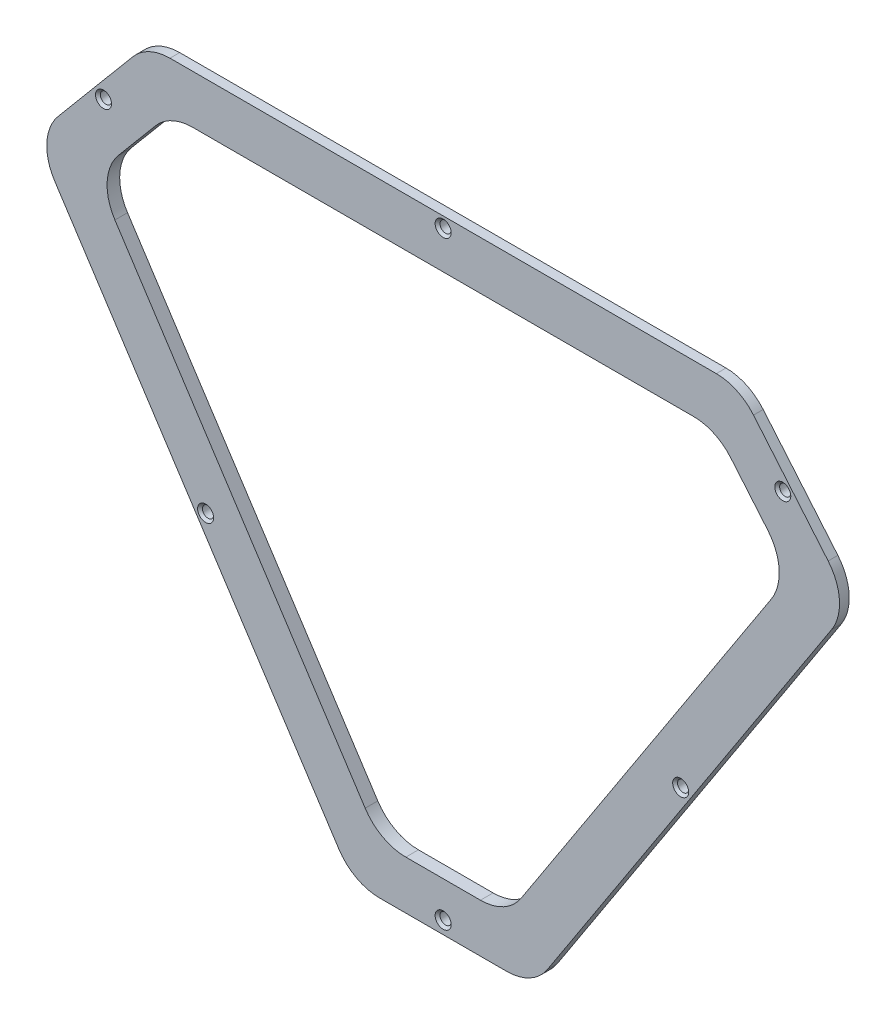
from build123d import *

# Parameters (mm, degrees)
BOSS_EXTRU_1_DEPTH      = 2
CONG_1_R                = 10
ENL_V_MAT_EXTRU_1_DEPTH = 2
BOSS_EXTRU_2_DEPTH      = 0.6
CONG_2_R                = 10
ESQUISSE3_R             = 1.15
ENL_V_MAT_EXTRU_2_DEPTH = 10
CHANFREIN1_SIZE         = 0.5
CHANFREIN3_SIZE         = 0.6


with BuildPart() as part:
    # Esquisse1 → Boss.-Extru.1 (new body)
    with BuildSketch(Plane.XY):
        Polygon((-40.879571388, 34.615718895), (81.042798068, 34.615718895), (104.193503713, 7.025782272), (38.617977526, -93.674532757), (1.545249154, -93.674532757), (-64.030277033, 7.025782272), align=None)
    extrude(amount=BOSS_EXTRU_1_DEPTH)

    # Congé1
    cong_1_edges = [part.edges().sort_by_distance(p)[0] for p in [
        (-40.879571388, 34.615718895, 1),
        (81.042798068, 34.615718895, 1),
        (104.193503713, 7.025782272, 1),
        (38.617977526, -93.674532757, 1),
        (1.545249154, -93.674532757, 1),
        (-64.030277033, 7.025782272, 1),
    ]]
    fillet(cong_1_edges, radius=CONG_1_R)

    # Esquisse2 → Enlèv. mat.-Extru.1 (cut)
    with BuildSketch(Plane.XY.offset(2)):
        Polygon((-36.216494806, 24.615718895), (-51.607204261, 6.27378561), (6.96667711, -83.674532757), (33.19654957, -83.674532757), (91.770430941, 6.27378561), (76.379721487, 24.615718895), align=None)
    extrude(amount=-ENL_V_MAT_EXTRU_1_DEPTH, mode=Mode.SUBTRACT)

    # Esquisse4 → Boss.-Extru.2 (add)
    with BuildSketch(Plane(origin=(0, 0, 0), x_dir=(-1, 0, 0), z_dir=(0, 0, -1))):
        Polygon((-78.244952119, 28.615718895), (-96.73966005, 6.574584275), (-35.365120753, -87.674532757), (-4.798105928, -87.674532757), (56.57643337, 6.574584275), (38.081725439, 28.615718895), align=None)
        Polygon((-76.379721487, 24.615718895), (-91.770430941, 6.27378561), (-33.19654957, -83.674532757), (-6.96667711, -83.674532757), (51.607204261, 6.27378561), (36.216494806, 24.615718895), align=None, mode=Mode.SUBTRACT)
    extrude(amount=BOSS_EXTRU_2_DEPTH)

    # Congé2
    cong_2_edges = [part.edges().sort_by_distance(p)[0] for p in [
        (-36.216494806, 24.615718895, 0.7),
        (76.379721487, 24.615718895, 0.7),
        (91.770430941, 6.27378561, 0.7),
        (33.19654957, -83.674532757, 0.7),
        (6.96667711, -83.674532757, 0.7),
        (-51.607204261, 6.27378561, 0.7),
    ]]
    fillet(cong_2_edges, radius=CONG_2_R)

    # Esquisse3 → Enlèv. mat.-Extru.2 (cut)
    with BuildSketch(Plane.XY.offset(2)):
        with Locations((20.08161334, -91.058073416)):
            Circle(ESQUISSE3_R)
        with Locations((-28.872824595, -42.931783887)):
            Circle(ESQUISSE3_R)
        with Locations((20.08161334, 32.415718895)):
            Circle(ESQUISSE3_R)
        with Locations((90.076701777, 20.426939275)):
            Circle(ESQUISSE3_R)
        with Locations((69.036051275, -42.931783887)):
            Circle(ESQUISSE3_R)
        with Locations((-49.913475097, 20.426939275)):
            Circle(ESQUISSE3_R)
    extrude(amount=-ENL_V_MAT_EXTRU_2_DEPTH, mode=Mode.SUBTRACT)

    # Chanfrein1
    chanfrein1_edges = [part.edges().sort_by_distance(p)[0] for p in [
        (-51.063475097, 20.426939275, 2),
        (67.886051275, -42.931783887, 2),
        (88.926701777, 20.426939275, 2),
        (18.93161334, 32.415718895, 2),
        (-30.022824595, -42.931783887, 2),
        (18.93161334, -91.058073416, 2),
    ]]
    chamfer(chanfrein1_edges, length=CHANFREIN1_SIZE)

    # Chanfrein3
    chanfrein3_edges = [part.edges().sort_by_distance(p)[0] for p in [
        (87.492306084, 17.595151585, -0.6),
        (20.08161334, 28.615718895, -0.6),
        (-47.329079404, 17.595151585, -0.6),
        (-25.889163721, -40.549974241, -0.6),
        (20.08161334, -87.674532757, -0.6),
        (66.052390401, -40.549974241, -0.6),
    ]]
    chamfer(chanfrein3_edges, length=CHANFREIN3_SIZE - 0.0001)  # a hair under: the kernel refuses the full size


solid = part.part
